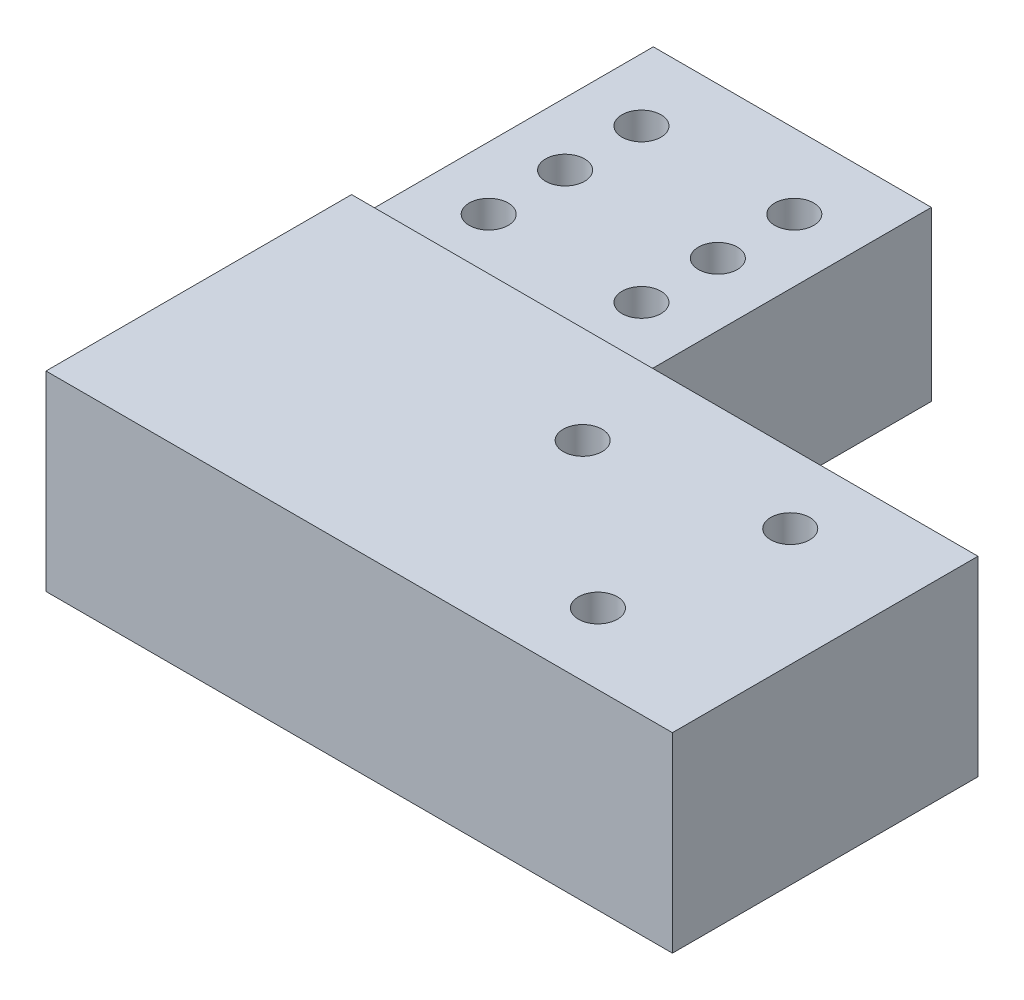
from build123d import *

# Parameters (mm, degrees)
SKETCH1_W               = 36.4
SKETCH1_H               = 39.5
SKETCH1_R               = 2.55
BOSS_EXTRUDE1_DEPTH     = 22
BOSS_EXTRUDE2_START     = -22
SKETCH2_W               = 82
SKETCH2_H               = 40
BOSS_EXTRUDE2_DEPTH     = 25
F_5_0MM_DOWEL_HOLE1_D   = 5.1
CUT_EXTRUDE1_DEPTH      = 30
CUT_EXTRUDE1_DEPTH_BACK = 50
SKETCH3_W               = 85.710853131
SKETCH3_H               = 93.141989814


with BuildPart() as part:
    # Sketch1 → Boss-Extrude1 (new body)
    with BuildSketch(Plane(origin=(0, 0, 0), x_dir=(1, 0, 0), z_dir=(0, 1, 0))):
        with Locations((18.2, 19.75)):
            Rectangle(SKETCH1_W, SKETCH1_H)
        with Locations((8.2, 29.75)):
            Circle(SKETCH1_R, mode=Mode.SUBTRACT)
        with Locations((28.2, 29.75)):
            Circle(SKETCH1_R, mode=Mode.SUBTRACT)
        with Locations((28.2, 19.75)):
            Circle(SKETCH1_R, mode=Mode.SUBTRACT)
        with Locations((28.2, 9.75)):
            Circle(SKETCH1_R, mode=Mode.SUBTRACT)
        with Locations((8.2, 19.75)):
            Circle(SKETCH1_R, mode=Mode.SUBTRACT)
        with Locations((8.2, 9.75)):
            Circle(SKETCH1_R, mode=Mode.SUBTRACT)
    boss_extrude1 = extrude(amount=BOSS_EXTRUDE1_DEPTH)

    # Sketch2 → Boss-Extrude2 (add)
    with BuildSketch(Plane(origin=(0, 22, 0), x_dir=(1, 0, 0), z_dir=(0, 1, 0)).offset(BOSS_EXTRUDE2_START)):
        with Locations((41, 59.5)):
            Rectangle(SKETCH2_W, SKETCH2_H)
    boss_extrude2 = extrude(amount=BOSS_EXTRUDE2_DEPTH)

    # Mirror3: Boss-Extrude1, Boss-Extrude2 across plane
    add(boss_extrude1.mirror(Plane(origin=(0, 22, 0), x_dir=(1, 0, 0), z_dir=(0, 0, -1))))
    add(boss_extrude2.mirror(Plane(origin=(0, 22, 0), x_dir=(1, 0, 0), z_dir=(0, 0, -1))))

    # Ø5.0mm Dowel Hole1 (through all)
    with Locations(Plane(origin=(42.996100309, 25, 52.24566701), x_dir=(0, 0, 1), z_dir=(0, 1, 0))):
        with Locations((0, 0), (18, 20), (-3.585786438, 23.585786437)):
            Hole(F_5_0MM_DOWEL_HOLE1_D / 2)

    # Sketch3 → Cut-Extrude1 (cut, two sides: drawn at the far end of the back side and taken through both)
    with BuildSketch(Plane(origin=(0, 22, 0), x_dir=(1, 0, 0), z_dir=(0, 1, 0)).offset(-CUT_EXTRUDE1_DEPTH_BACK)):
        with Locations((42.855426566, 46.570994907)):
            Rectangle(SKETCH3_W, SKETCH3_H)
    extrude(amount=CUT_EXTRUDE1_DEPTH + CUT_EXTRUDE1_DEPTH_BACK, mode=Mode.SUBTRACT)


solid = part.part
